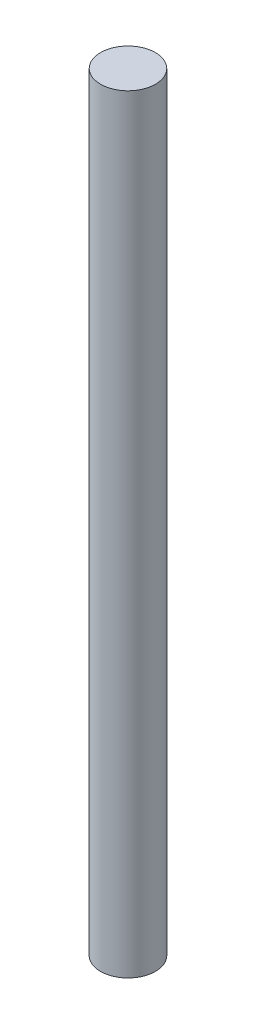
from build123d import *

# Parameters (mm, degrees)
SKETCH_1_R      = 2.5
EXTRUDE_1_DEPTH = 70


with BuildPart() as part:
    # Эскиз1 → Вытянуть1 (new body)
    with BuildSketch(Plane(origin=(0, 0, 0), x_dir=(1, 0, 0), z_dir=(0, 1, 0))):
        Circle(SKETCH_1_R)
    extrude(amount=EXTRUDE_1_DEPTH)


solid = part.part
